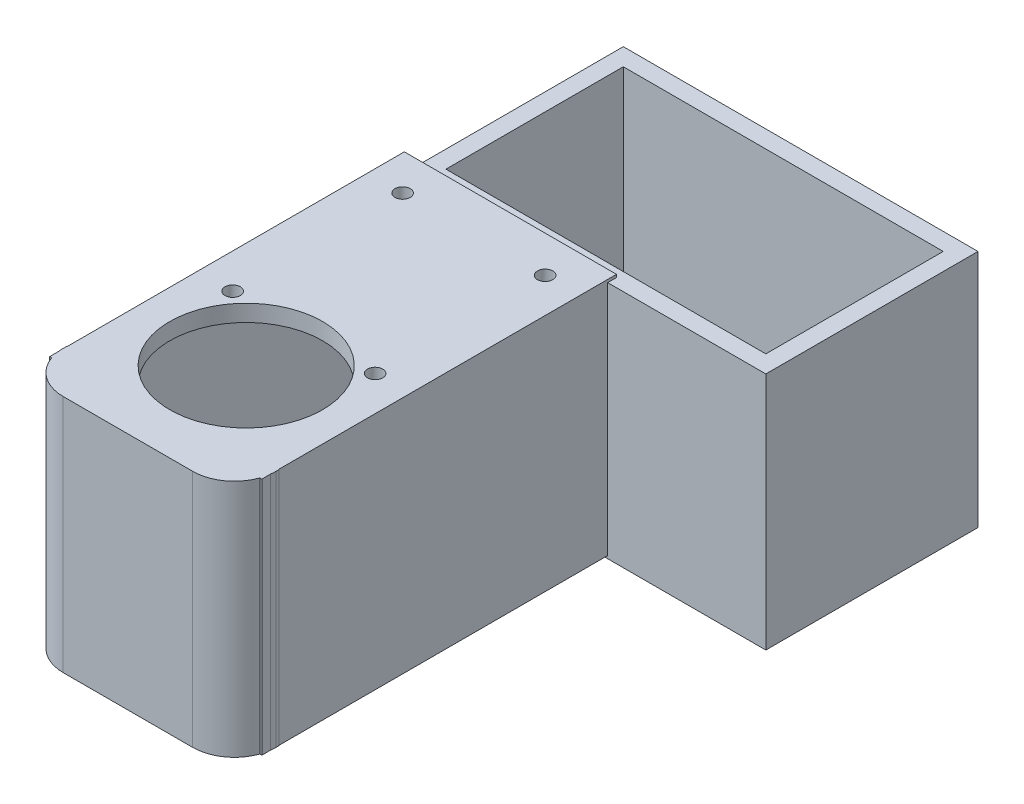
from build123d import *

# Parameters (mm, degrees)
S_BOX1_W      = 30.52
S_BOX1_H      = 34.4
BOSS_1_DEPTH  = 2.5
S_BOX2_W      = 30.52
S_BOX2_H      = 34.4
BOSS_2_DEPTH  = 2.5
S_BOX3_W      = 2.5
S_BOX3_H      = 34.4
BOSS_3_DEPTH  = 51.02
S_BOX4_W      = 2.5
S_BOX4_H      = 34.4
BOSS_4_DEPTH  = 51.02
S_BOX5_W      = 30.52
S_BOX5_H      = 2.4
BOSS_5_DEPTH  = 51.02
S_BOX6_W      = 2.5
S_BOX6_H      = 34.4
BOSS_6_DEPTH  = 30.52
S_BOX7_W      = 2.5
S_BOX7_H      = 34.4
BOSS_7_DEPTH  = 30.52
S_BOX8_W      = 51.02
S_BOX8_H      = 34.4
BOSS_8_DEPTH  = 2.5
S_BOX9_W      = 51.02
S_BOX9_H      = 34.4
BOSS_9_DEPTH  = 2.5
S_BOX10_W     = 51.02
S_BOX10_H     = 2.4
BOSS_10_DEPTH = 30.52
BOSS_11_DEPTH = 34.4
S_HOLE12_R    = 11
HOLE_12_DEPTH = 2.6
S_HOLE13_R    = 1.1
HOLE_13_DEPTH = 2.6
S_HOLE14_R    = 1.1
HOLE_14_DEPTH = 2.6
S_HOLE15_R    = 1.1
HOLE_15_DEPTH = 2.6
S_HOLE16_R    = 1.1
HOLE_16_DEPTH = 2.6
S_HOLE17_R    = 11
HOLE_17_DEPTH = 2.6
S_HOLE18_R    = 1.1
HOLE_18_DEPTH = 2.6
S_HOLE19_R    = 1.1
HOLE_19_DEPTH = 2.6
S_HOLE20_R    = 1.1
HOLE_20_DEPTH = 2.6
S_HOLE21_R    = 1.1
HOLE_21_DEPTH = 2.6


with BuildPart() as part:
    # S_box1 → Boss_1 (new body)
    with BuildSketch(Plane.XY.offset(-38.01)):
        with Locations((0, 19.825)):
            Rectangle(S_BOX1_W, S_BOX1_H)
    extrude(amount=BOSS_1_DEPTH)



with BuildPart() as body_2:
    # S_box2 → Boss_2 (new body)
    with BuildSketch(Plane.XY.offset(10.51)):
        with Locations((0, 19.825)):
            Rectangle(S_BOX2_W, S_BOX2_H)
    extrude(amount=BOSS_2_DEPTH)


with BuildPart() as part_1:
    add(part.part)

    add(body_2.part)  # Boss_3 merges body 2
    # S_box3 → Boss_3 (add)
    with BuildSketch(Plane.XY.offset(-38.01)):
        with Locations((-14.01, 19.825)):
            Rectangle(S_BOX3_W, S_BOX3_H)
    extrude(amount=BOSS_3_DEPTH)

    # S_box4 → Boss_4 (add)
    with BuildSketch(Plane.XY.offset(-38.01)):
        with Locations((14.01, 19.825)):
            Rectangle(S_BOX4_W, S_BOX4_H)
    extrude(amount=BOSS_4_DEPTH)

    # S_box5 → Boss_5 (add)
    with BuildSketch(Plane.XY.offset(-38.01)):
        with Locations((0, 35.825)):
            Rectangle(S_BOX5_W, S_BOX5_H)
    extrude(amount=BOSS_5_DEPTH)

    # S_box6 → Boss_6 (add)
    with BuildSketch(Plane.XY.offset(-67.26)):
        with Locations((-11.76, 19.425)):
            Rectangle(S_BOX6_W, S_BOX6_H)
    extrude(amount=BOSS_6_DEPTH)



with BuildPart() as body_2_2:
    # S_box7 → Boss_7 (new body)
    with BuildSketch(Plane.XY.offset(-67.26)):
        with Locations((36.76, 19.425)):
            Rectangle(S_BOX7_W, S_BOX7_H)
    extrude(amount=BOSS_7_DEPTH)


with BuildPart() as part_2:
    add(part_1.part)

    add(body_2_2.part)  # Boss_8 merges body 2 2
    # S_box8 → Boss_8 (add)
    with BuildSketch(Plane.XY.offset(-67.26)):
        with Locations((12.5, 19.425)):
            Rectangle(S_BOX8_W, S_BOX8_H)
    extrude(amount=BOSS_8_DEPTH)

    # S_box9 → Boss_9 (add)
    with BuildSketch(Plane.XY.offset(-39.24)):
        with Locations((12.5, 19.425)):
            Rectangle(S_BOX9_W, S_BOX9_H)
    extrude(amount=BOSS_9_DEPTH)

    # S_box10 → Boss_10 (add)
    with BuildSketch(Plane.XY.offset(-67.26)):
        with Locations((12.5, 3.425)):
            Rectangle(S_BOX10_W, S_BOX10_H)
    extrude(amount=BOSS_10_DEPTH)

    # S_prism11 → Boss_11 (add)
    with BuildSketch(Plane(origin=(0, 2.625, 0), x_dir=(1, 0, 0), z_dir=(0, 1, 0))):
        with BuildLine():
            Line((-15.31, -10.56), (15.31, -10.56))
            Line((15.31, -10.56), (15.31, -11.01))
            ThreePointArc((15.31, -11.01), (13.5526, -15.2526), (9.31, -17.01))
            Line((9.31, -17.01), (-9.31, -17.01))
            ThreePointArc((-9.31, -17.01), (-13.5526, -15.2526), (-15.31, -11.01))
            Line((-15.31, -11.01), (-15.31, -10.56))
        make_face()
    extrude(amount=BOSS_11_DEPTH)

    # S_hole12 → Hole_12 (cut)
    with BuildSketch(Plane(origin=(0, 34.525, 0), x_dir=(1, 0, 0), z_dir=(0, 1, 0))):
        Circle(S_HOLE12_R)
    extrude(amount=HOLE_12_DEPTH, mode=Mode.SUBTRACT)

    # S_hole13 → Hole_13 (cut)
    with BuildSketch(Plane(origin=(0, 34.525, 0), x_dir=(1, 0, 0), z_dir=(0, 1, 0))):
        with Locations((-10.25, 8.3)):
            Circle(S_HOLE13_R)
    extrude(amount=HOLE_13_DEPTH, mode=Mode.SUBTRACT)

    # S_hole14 → Hole_14 (cut)
    with BuildSketch(Plane(origin=(0, 34.525, 0), x_dir=(1, 0, 0), z_dir=(0, 1, 0))):
        with Locations((10.25, 8.3)):
            Circle(S_HOLE14_R)
    extrude(amount=HOLE_14_DEPTH, mode=Mode.SUBTRACT)

    # S_hole15 → Hole_15 (cut)
    with BuildSketch(Plane(origin=(0, 34.525, 0), x_dir=(1, 0, 0), z_dir=(0, 1, 0))):
        with Locations((-10.25, 32.75)):
            Circle(S_HOLE15_R)
    extrude(amount=HOLE_15_DEPTH, mode=Mode.SUBTRACT)

    # S_hole16 → Hole_16 (cut)
    with BuildSketch(Plane(origin=(0, 34.525, 0), x_dir=(1, 0, 0), z_dir=(0, 1, 0))):
        with Locations((10.25, 32.75)):
            Circle(S_HOLE16_R)
    extrude(amount=HOLE_16_DEPTH, mode=Mode.SUBTRACT)

    # S_hole17 → Hole_17 (cut)
    with BuildSketch(Plane(origin=(0, 2.125, 0), x_dir=(1, 0, 0), z_dir=(0, 1, 0))):
        with Locations((0, 52)):
            Circle(S_HOLE17_R)
    extrude(amount=HOLE_17_DEPTH, mode=Mode.SUBTRACT)

    # S_hole18 → Hole_18 (cut)
    with BuildSketch(Plane(origin=(0, 2.125, 0), x_dir=(1, 0, 0), z_dir=(0, 1, 0))):
        with Locations((8.3, 62.25)):
            Circle(S_HOLE18_R)
    extrude(amount=HOLE_18_DEPTH, mode=Mode.SUBTRACT)

    # S_hole19 → Hole_19 (cut)
    with BuildSketch(Plane(origin=(0, 2.125, 0), x_dir=(1, 0, 0), z_dir=(0, 1, 0))):
        with Locations((8.3, 41.75)):
            Circle(S_HOLE19_R)
    extrude(amount=HOLE_19_DEPTH, mode=Mode.SUBTRACT)

    # S_hole20 → Hole_20 (cut)
    with BuildSketch(Plane(origin=(0, 2.125, 0), x_dir=(1, 0, 0), z_dir=(0, 1, 0))):
        with Locations((32.75, 62.25)):
            Circle(S_HOLE20_R)
    extrude(amount=HOLE_20_DEPTH, mode=Mode.SUBTRACT)

    # S_hole21 → Hole_21 (cut)
    with BuildSketch(Plane(origin=(0, 2.125, 0), x_dir=(1, 0, 0), z_dir=(0, 1, 0))):
        with Locations((32.75, 41.75)):
            Circle(S_HOLE21_R)
    extrude(amount=HOLE_21_DEPTH, mode=Mode.SUBTRACT)


solid = part_2.part
